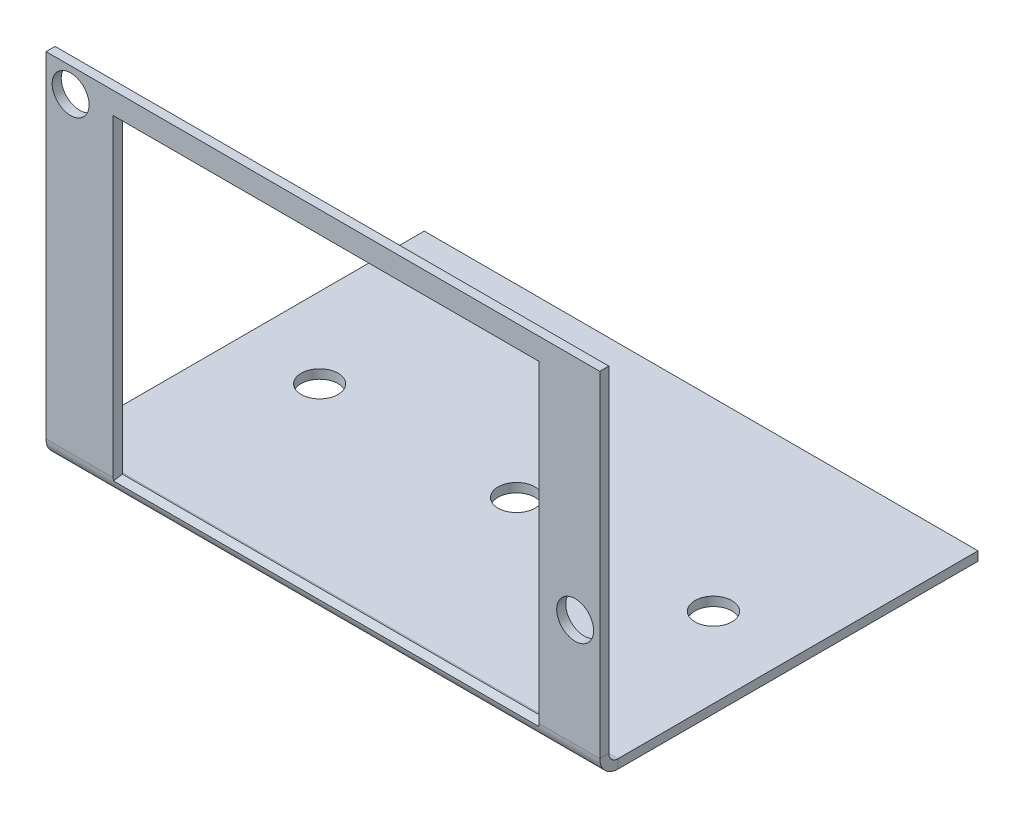
from build123d import *

# Parameters (mm, degrees)
BASE_FLANGE1_DEPTH = 22.5
SKETCH6_R          = 1.5
CUT_EXTRUDE2_DEPTH = 47.800106837
SKETCH8_R          = 1.5
CUT_EXTRUDE3_DEPTH = 47.800106837
CUT_EXTRUDE5_START = -17.038685437
CUT_EXTRUDE5_DEPTH = 34.599471918


# Read off the part's stored shape, not the designer's step: Cut-Extrude5
# Sheet-metal steps are written as plain solids
with BuildPart() as part:
    # Sketch2 → Base-Flange1 (new, symmetric)
    with BuildSketch(Plane(origin=(0, 0, 0), x_dir=(0, 0, -1), z_dir=(1, 0, 0))):
        with BuildLine():
            Line((30, 0), (0.7366, 0))
            ThreePointArc((0.7366, 0), (0.215745145, 0.215745145), (0, 0.7366))
            Line((0, 0.7366), (0, 28))
            Line((0, 28), (-0.7366, 28))
            Line((-0.7366, 28), (-0.7366, 0.7366))
            ThreePointArc((-0.7366, 0.7366), (-0.30510971, -0.30510971), (0.7366, -0.7366))
            Line((0.7366, -0.7366), (30, -0.7366))
            Line((30, -0.7366), (30, 0))
        make_face()
    extrude(amount=BASE_FLANGE1_DEPTH, both=True)

    # Sketch6 → Cut-Extrude2 (cut, through all)
    with BuildSketch(Plane(origin=(0, 0, 0), x_dir=(-1, 0, 0), z_dir=(0, 0, -1))):
        with Locations((-20.5, 9.5)):
            Circle(SKETCH6_R)
        with Locations((20.5, 26)):
            Circle(SKETCH6_R)
    extrude(amount=-CUT_EXTRUDE2_DEPTH, mode=Mode.SUBTRACT)

    # Sketch8 → Cut-Extrude3 (cut, through all)
    with BuildSketch(Plane(origin=(0, 0, 0), x_dir=(1, 0, 0), z_dir=(0, 1, 0))):
        with Locations(Location((0, 15, 0), (0, 0, 270))):
            Circle(SKETCH8_R)
        with Locations(Location((-16, 15, 0), (0, 0, 270))):
            Circle(SKETCH8_R)
    cut_extrude3 = extrude(amount=-CUT_EXTRUDE3_DEPTH, mode=Mode.SUBTRACT)

    # Mirror1: Cut-Extrude3 across plane
    add(cut_extrude3.mirror(Plane(origin=(0, 0, 0), x_dir=(0, 0, 1), z_dir=(1, 0, 0))), mode=Mode.SUBTRACT)

    # Cut-Extrude5 outline → Cut-Extrude5 (cut)
    with BuildSketch(Plane.YZ.offset(CUT_EXTRUDE5_START)):
        with BuildLine():
            ThreePointArc((0.7366, 0.7366), (0.620934378, 0.732052343), (0.505982859, 0.718437448))
            Line((0.505982859, 0.718437448), (0.62129143, -0.009081276))
            ThreePointArc((0.62129143, -0.009081276), (0.678767189, -0.002273829), (0.7366, 0))
            Line((0.7366, 0), (26.231735093, 0))
            Line((26.231735093, 0), (26.231735093, 0.7366))
            Line((26.231735093, 0.7366), (0.7366, 0.7366))
        make_face()
    extrude(amount=CUT_EXTRUDE5_DEPTH, mode=Mode.SUBTRACT)


solid = part.part
